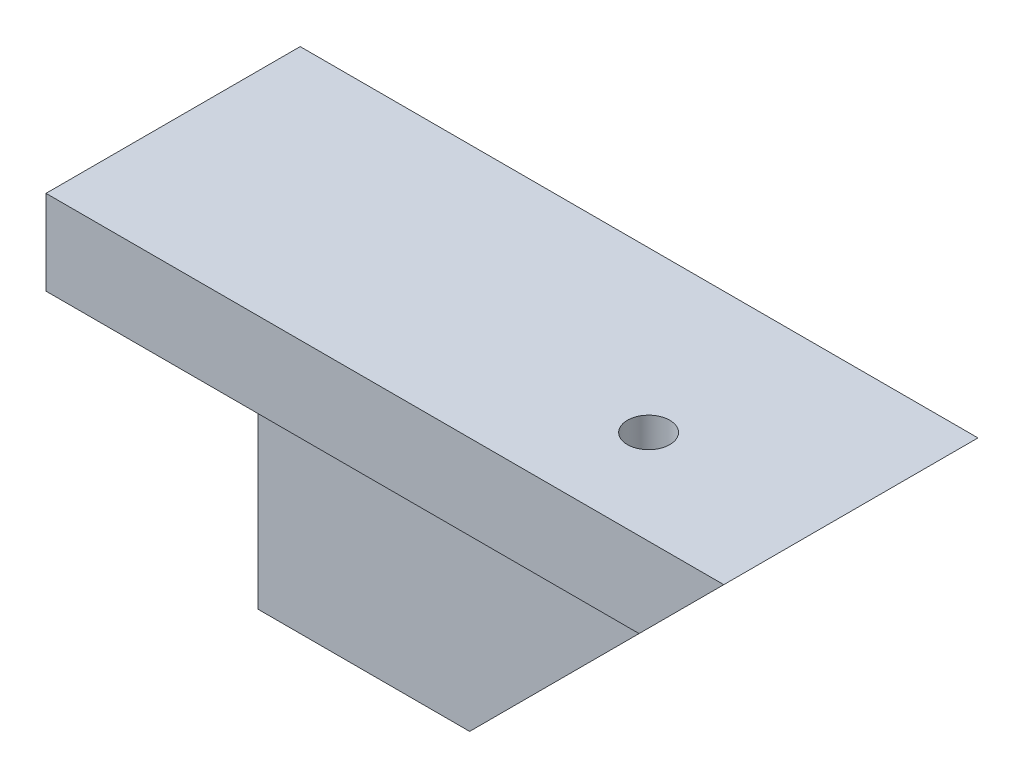
from build123d import *

# Parameters (mm, degrees)
BOSS_EXTRUDE1_DEPTH = 5
BOSS_EXTRUDE2_DEPTH = 25
SKETCH4_R           = 2.5
CUT_EXTRUDE1_DEPTH  = 75.330343737


with BuildPart() as part:
    # Sketch1 → Boss-Extrude1 (new body)
    with BuildSketch(Plane.XY):
        Polygon((40, 27.5), (-15, -27.5), (-40, -27.5), (-40, 27.5), align=None)
    extrude(amount=BOSS_EXTRUDE1_DEPTH)

    # Sketch3 → Boss-Extrude2 (add)
    with BuildSketch(Plane.XY.offset(5)):
        Polygon((-40, 27.5), (40, 27.5), (30, 17.5), (-40, 17.5), align=None)
    extrude(amount=BOSS_EXTRUDE2_DEPTH)

    # Sketch4 → Cut-Extrude1 (cut, through all)
    with BuildSketch(Plane(origin=(0, 27.5, 0), x_dir=(1, 0, 0), z_dir=(0, 1, 0))):
        with Locations((20, -18.88)):
            Circle(SKETCH4_R)
    extrude(amount=-CUT_EXTRUDE1_DEPTH, mode=Mode.SUBTRACT)


solid = part.part
